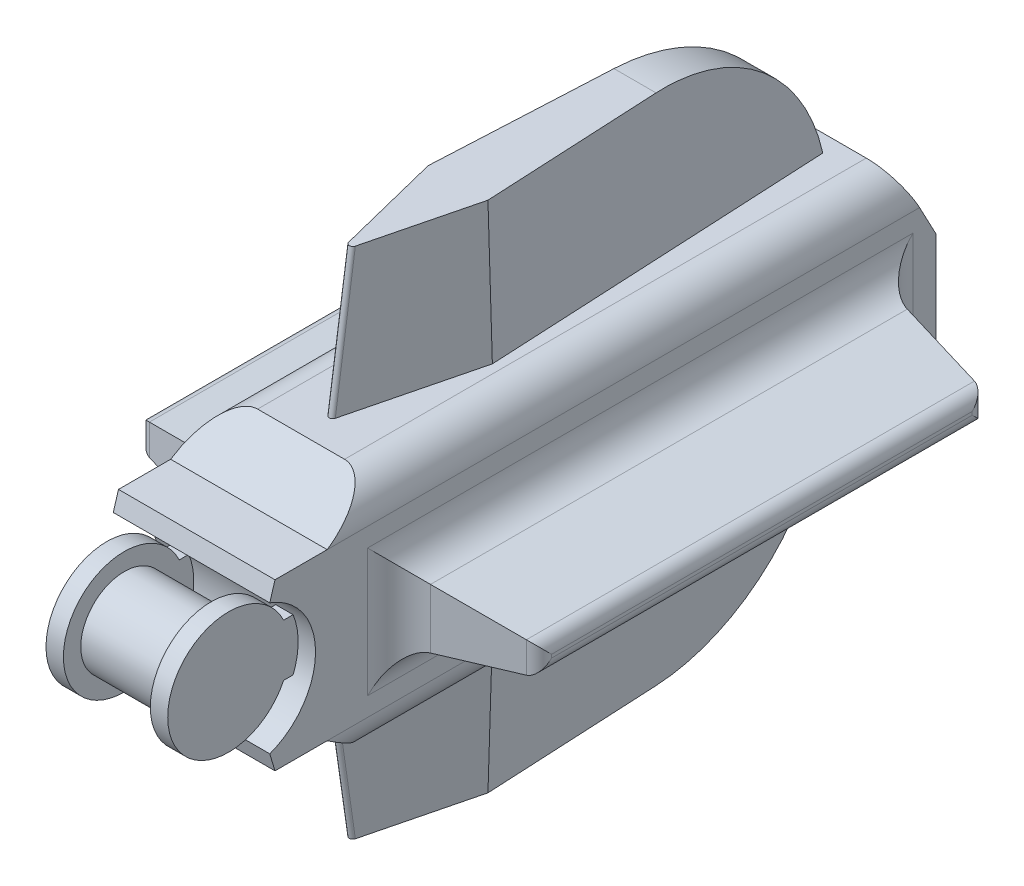
from build123d import *

# Parameters (mm, degrees)
SKETCH1_R                = 3.175
BOSS_EXTRUDE1_DEPTH      = 3.175
SKETCH2_R                = 4.445
BOSS_EXTRUDE2_DEPTH      = 1.27
SKETCH3_W                = 6.35
SKETCH3_H                = 3.81
BOSS_EXTRUDE3_DEPTH      = 1.27
BOSS_EXTRUDE4_DEPTH      = 8.89
BOSS_EXTRUDE4_DEPTH_BACK = 2.54
SKETCH5_R                = 3.175
CUT_EXTRUDE1_DEPTH       = 12.7
FILLET1_R                = 2.54
SKETCH6_W                = 35.56
SKETCH6_H                = 5.08
BOSS_EXTRUDE5_DEPTH      = 8.89
BOSS_EXTRUDE5_TAPER      = 10
FILLET2_R                = 1.016
FILLET3_R                = 2.54
BOSS_EXTRUDE6_DEPTH      = 10.16
BOSS_EXTRUDE6_TAPER      = 2
FILLET4_R                = 0.254
FILLET5_R                = 12.7


with BuildPart() as part:
    # Sketch1 → Boss-Extrude1 (new, symmetric)
    with BuildSketch(Plane(origin=(0, 0, 0), x_dir=(0, 0, -1), z_dir=(1, 0, 0))):
        Circle(SKETCH1_R)
    extrude(amount=BOSS_EXTRUDE1_DEPTH, both=True)

    # Sketch2 → Boss-Extrude2 (add)
    with BuildSketch(Plane(origin=(3.175, 0, 0), x_dir=(0, 0, -1), z_dir=(1, 0, 0))):
        Circle(SKETCH2_R)
    boss_extrude2 = extrude(amount=BOSS_EXTRUDE2_DEPTH)

    # Mirror1: Boss-Extrude2 across plane
    add(boss_extrude2.mirror(Plane(origin=(0, 0, 0), x_dir=(0, 0, 1), z_dir=(1, 0, 0))))

    # Sketch3 → Boss-Extrude3 (add)
    with BuildSketch(Plane(origin=(4.445, 0, 0), x_dir=(0, 0, -1), z_dir=(1, 0, 0))):
        with Locations((3.175, 0)):
            Rectangle(SKETCH3_W, SKETCH3_H)
    boss_extrude3 = extrude(amount=-BOSS_EXTRUDE3_DEPTH)

    # Mirror2: Boss-Extrude3 across plane
    add(boss_extrude3.mirror(Plane(origin=(0, 0, 0), x_dir=(0, 0, 1), z_dir=(1, 0, 0))))

    # Sketch4 → Boss-Extrude4 (add, two sides: drawn at the far end of the back side and taken through both)
    with BuildSketch(Plane(origin=(-3.175, 0, 0), x_dir=(0, 0, -1), z_dir=(1, 0, 0)).offset(-BOSS_EXTRUDE4_DEPTH_BACK)):
        with BuildLine():
            Line((1.737462328, 4.773638514), (2.118462328, 6.043638514))
            Line((2.118462328, 6.043638514), (5.928462328, 6.043638514))
            Line((5.928462328, 6.043638514), (9.738462328, 8.583638514))
            Line((9.738462328, 8.583638514), (47.838462328, 8.583638514))
            Line((47.838462328, 8.583638514), (50.378462328, 3.81))
            Line((50.378462328, 3.81), (50.378462328, -3.81))
            Line((50.378462328, -3.81), (47.838462328, -8.583638514))
            Line((47.838462328, -8.583638514), (9.738462328, -8.583638514))
            Line((9.738462328, -8.583638514), (5.928462328, -6.043638514))
            Line((5.928462328, -6.043638514), (2.118462328, -6.043638514))
            Line((2.118462328, -6.043638514), (1.737462328, -4.773638514))
            ThreePointArc((1.737462328, -4.773638514), (5.08, 0), (1.737462328, 4.773638514))
        make_face()
    extrude(amount=BOSS_EXTRUDE4_DEPTH + BOSS_EXTRUDE4_DEPTH_BACK)

    # Sketch5 → Cut-Extrude1 (cut)
    with BuildSketch(Plane(origin=(0, 0, -50.378462328), x_dir=(-1, 0, 0), z_dir=(0, 0, -1))):
        Circle(SKETCH5_R)
    extrude(amount=-CUT_EXTRUDE1_DEPTH, mode=Mode.SUBTRACT)

    # Fillet1
    fillet1_edges = [part.edges().sort_by_distance(p)[0] for p in [
        (5.715, -8.583638514, -28.788462328),
        (-5.715, -8.583638514, -28.788462328),
        (-5.715, 8.583638514, -28.788462328),
        (5.715, 8.583638514, -28.788462328),
    ]]
    fillet(fillet1_edges, radius=FILLET1_R)

    # Sketch6 → Boss-Extrude5 (add)
    with BuildSketch(Plane(origin=(5.715, 0, 0), x_dir=(0, 0, -1), z_dir=(1, 0, 0))):
        with Locations((28.788462328, 0)):
            Rectangle(SKETCH6_W, SKETCH6_H)
    boss_extrude5 = extrude(amount=BOSS_EXTRUDE5_DEPTH, taper=BOSS_EXTRUDE5_TAPER)

    # Mirror3: Boss-Extrude5 across plane
    add(boss_extrude5.mirror(Plane(origin=(0, 0, 0), x_dir=(0, 0, 1), z_dir=(1, 0, 0))))

    # Fillet2
    fillet2_edges = [part.edges().sort_by_distance(p)[0] for p in [
        (14.605, 0, -12.576009187),
        (14.605, -0.972453142, -28.788462328),
        (14.605, 0, -45.00091547),
        (14.605, 0.972453142, -28.788462328),
        (-14.605, 0, -12.576009187),
        (-14.605, 0.972453142, -28.788462328),
        (-14.605, 0, -45.00091547),
        (-14.605, -0.972453142, -28.788462328),
    ]]
    fillet(fillet2_edges, radius=FILLET2_R)

    # Fillet3
    fillet3_edges = [part.edges().sort_by_distance(p)[0] for p in [
        (5.715, 0, -11.008462328),
        (5.715, -2.54, -28.788462328),
        (5.715, 0, -46.568462328),
        (5.715, 2.54, -28.788462328),
        (-5.715, 0, -11.008462328),
        (-5.715, -2.54, -28.788462328),
        (-5.715, 0, -46.568462328),
        (-5.715, 2.54, -28.788462328),
    ]]
    fillet(fillet3_edges, radius=FILLET3_R)

    # Sketch7 → Boss-Extrude6 (add)
    with BuildSketch(Plane(origin=(0, 8.583638514, 0), x_dir=(1, 0, 0), z_dir=(0, 1, 0))):
        Polygon((-1.27, 46.568462328), (-2.54, 21.168462328), (0, 11.008462328), (2.54, 21.168462328), (1.27, 46.568462328), align=None)
    boss_extrude6 = extrude(amount=BOSS_EXTRUDE6_DEPTH, taper=BOSS_EXTRUDE6_TAPER)

    # Mirror4: Boss-Extrude6 across plane
    add(boss_extrude6.mirror(Plane.ZX))

    # Fillet4
    fillet4_edges = [part.edges().sort_by_distance(p)[0] for p in [
        (0, 13.663638514, -11.739890995),
        (0, -13.663638514, -11.739890995),
    ]]
    fillet(fillet4_edges, radius=FILLET4_R)

    # Fillet5
    # the kernel refuses this fillet: 12.7 mm, written as the material it takes off along each edge
    with BuildSketch(Plane(origin=(31.154033704, -18.743638514, -46.21366731), x_dir=(0, 0.9993908270191081, -0.034899496702148744), z_dir=(-1, 0, 0))) as fillet5_piece_1:
        with BuildLine():
            CenterArc((12.270376998, -12.524472427), FILLET5_R, 99.536959033, 78.463040967)
            Line((-0.421886505, -12.081248819), (-0.675731775, -12.072384347))
            Line((-0.675731775, -12.072384347), (-0.25384527, 0.008864472))
            Line((-0.25384527, 0.008864472), (0, 0.254))
            ThreePointArc((0, 0.254), (5.083096485, 0.254), (10.12410929, 0.250489449))
            Line((10.12410929, 0.250489449), (10.16619297, 0))
        make_face()
    extrude(amount=62.308067408, mode=Mode.SUBTRACT)
    with BuildSketch(Plane(origin=(31.154033704, 18.743638514, -46.21366731), x_dir=(0, -0.9993908270191081, -0.034899496702148744), z_dir=(-1, 0, 0))) as fillet5_piece_2:
        with BuildLine():
            CenterArc((12.270376998, 12.524472427), FILLET5_R, 182, 78.463040967)
            Line((-0.421886505, 12.081248819), (-0.675731775, 12.072384347))
            Line((-0.675731775, 12.072384347), (-0.25384527, -0.008864472))
            Line((-0.25384527, -0.008864472), (0, -0.254))
            ThreePointArc((0, -0.254), (5.083096485, -0.254), (10.12410929, -0.250489449))
            Line((10.12410929, -0.250489449), (10.16619297, 0))
        make_face()
    extrude(amount=62.308067408, mode=Mode.SUBTRACT)


solid = part.part
